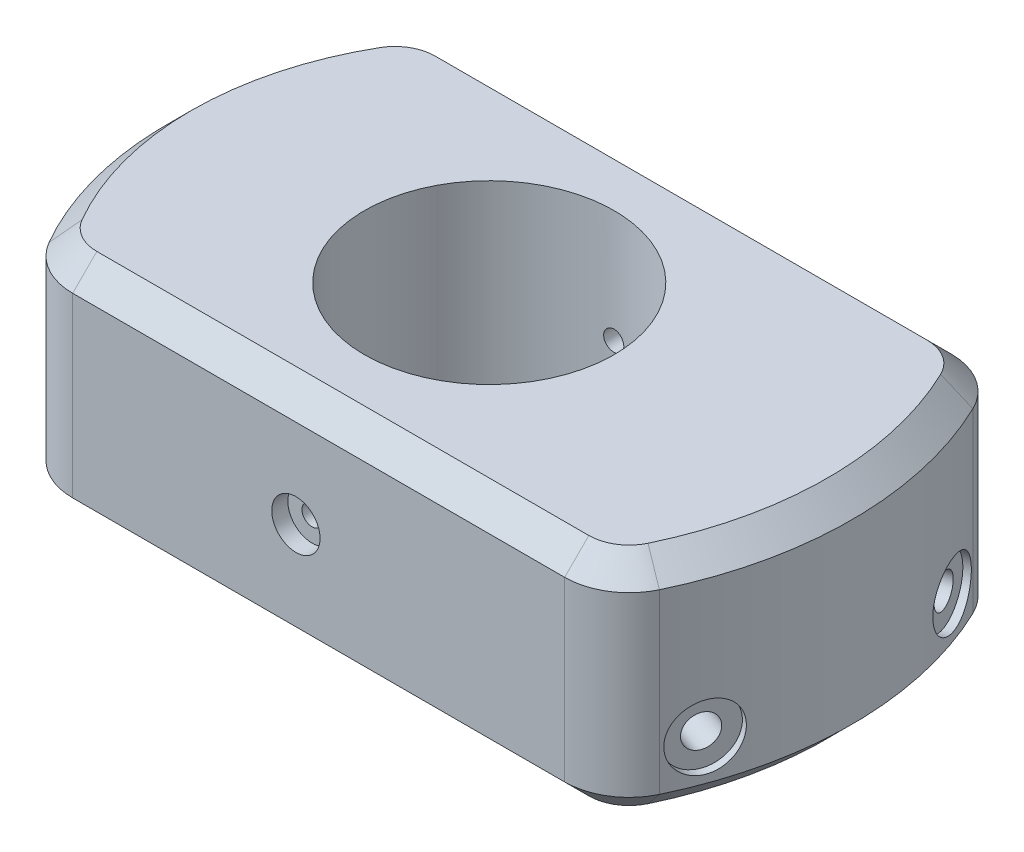
from build123d import *

# Parameters (mm, degrees)
SKETCH1_R               = 15.5
BOSS_EXTRUDE1_DEPTH     = 14
MOVE_START              = -14
MOVE_FACE1_DEPTH        = 28
CUT_EXTRUDE2_REACH      = 60.181
CUT_EXTRUDE2_END_RADIUS = 8.25
SKETCH5_R               = 2
SKETCH7_R               = 1.25
CUT_EXTRUDE3_DEPTH      = 68.268120394
FILLET1_R               = 8
CHAMFER1_SIZE           = 3
SKETCH8_R               = 3
CUT_EXTRUDE4_DEPTH      = 2


# Read off the part's stored shape, not the designer's step: Move Face1
with BuildPart() as part:
    # Sketch1 → Boss-Extrude1 (new, symmetric)
    with BuildSketch(Plane(origin=(0, 0, 0), x_dir=(1, 0, 0), z_dir=(0, 1, 0))):
        with BuildLine():
            Line((-32, 24), (32, 24))
            ThreePointArc((32, 24), (40, 0), (32, -24))
            Line((32, -24), (-32, -24))
            ThreePointArc((-32, -24), (-40, 0), (-32, 24))
        make_face()
        with Locations(Location((0, 0, 0), (0, 0, 270))):
            Circle(SKETCH1_R, mode=Mode.SUBTRACT)
    extrude(amount=BOSS_EXTRUDE1_DEPTH, both=True)

    # Sketch3 → Cut-Revolve1 (revolve, cut)
    with BuildSketch(Plane.XY):
        Polygon((-18, 2), (-19.432597466, 10.124663962), (-53.885297859, 4.049723325), (-52.452700394, -4.074940638), align=None)
    revolve(axis=Axis((-18, 2, 0), (-0.9848077530122092, -0.1736481776669237, 0)), mode=Mode.SUBTRACT)

    # Move Face1 outline → Move Face1 (add)
    with BuildSketch(Plane(origin=(0, 0, 0), x_dir=(1, 0, 0), z_dir=(0, 1, 0)).offset(MOVE_START)):
        with BuildLine():
            ThreePointArc((38.065732621, -24), (45, 0), (38.065732621, 24))
            Line((38.065732621, 24), (32, 24))
            ThreePointArc((32, 24), (40, 0), (32, -24))
            Line((32, -24), (38.065732621, -24))
        make_face()
    extrude(amount=MOVE_FACE1_DEPTH)

    # Sketch4 → Cut-Revolve2 (revolve, cut)
    with BuildSketch(Plane(origin=(0, 0, 0), x_dir=(0, -1, 0), z_dir=(-0.34202014332566943, 0, 0.9396926207859081)), mode=Mode.PRIVATE) as cut_revolve2_sk:
        Polygon((-6, 25), (-8.135257122, 32.968888067), (31.446035064, 43.574663343), (33.581292186, 35.605775277), align=None)
    cut_revolve2 = revolve(cut_revolve2_sk.sketch.rotate(Axis((23.49231552, 6, 8.550503583), (0.24321034680169487, -0.9659258262890681, 0.08852132690137743)), 160.629944791), axis=Axis((23.49231552, 6, 8.550503583), (0.24321034680169487, -0.9659258262890681, 0.08852132690137743)), mode=Mode.SUBTRACT)

    # Sketch6 → Cut-Revolve3 (revolve, cut)
    with BuildSketch(Plane(origin=(0, 0, 0), x_dir=(0, -1, 0), z_dir=(-0.34202014332566943, 0, 0.9396926207859081)), mode=Mode.PRIVATE) as cut_revolve3_sk:
        Polygon((4, 30), (6, 30), (6, 45), (6, 46), (2, 46), (2, 45), (2, 44), (4, 44), align=None)
    cut_revolve3 = revolve(cut_revolve3_sk.sketch.rotate(Axis((28.190778624, -6, 10.2606043), (0.9396926207859081, 0, 0.3420201433256695)), 90), axis=Axis((28.190778624, -6, 10.2606043), (0.9396926207859081, 0, 0.3420201433256695)), mode=Mode.SUBTRACT)

    # Mirror1: Cut-Revolve2, Cut-Revolve3 across plane
    add(cut_revolve2.mirror(Plane.XY), mode=Mode.SUBTRACT)
    add(cut_revolve3.mirror(Plane.XY), mode=Mode.SUBTRACT)

    # Cut-Extrude2: up to this cylinder (the profile starts outside it)
    cut_extrude2_end = Plane(origin=(-32.374316871, -0.534579894, 0), z_dir=(0.9848077530122092, 0.1736481776669237, 0)) * Cylinder(CUT_EXTRUDE2_END_RADIUS, 137.862, mode=Mode.PRIVATE)
    # Sketch5 → Cut-Extrude2 (cut, up to the surface)
    with BuildSketch(Plane.XZ.offset(14), mode=Mode.PRIVATE) as cut_extrude2_sk1:
        with Locations(Location((-30, 0, 0), (0, 0, 270))):
            Circle(SKETCH5_R)
    cut_extrude2_tool1 = extrude(cut_extrude2_sk1.sketch, amount=-CUT_EXTRUDE2_REACH, mode=Mode.PRIVATE) - cut_extrude2_end
    add(cut_extrude2_tool1.solids().sort_by_distance((-30, -14, 0))[0], mode=Mode.SUBTRACT)

    # Sketch7 → Cut-Extrude3 (cut, through all)
    with BuildSketch(Plane.XY.offset(24)):
        Circle(SKETCH7_R)
    extrude(amount=-CUT_EXTRUDE3_DEPTH, mode=Mode.SUBTRACT)

    # Fillet1
    fillet1_edges = [part.edges().sort_by_distance(p)[0] for p in [
        (-32, 0, -24),
        (38.065732621, 0, -24),
        (38.065732621, 0, 24),
        (-32, 0, 24),
    ]]
    fillet(fillet1_edges, radius=FILLET1_R)

    # Chamfer1
    chamfer1_edges = [part.edges().sort_by_distance(p)[0] for p in [
        (2.824420857, -14, -24),
        (2.824420857, 14, -24),
        (-40, -14, 0),
        (45, -14, 0),
        (2.824420857, -14, 24),
        (-31.712812921, -14, 22.92820323),
        (-31.712812921, -14, -22.92820323),
        (37.623363466, -14, 22.770364675),
        (37.623363466, -14, -22.770364675),
        (45, 14, 0),
        (-40, 14, 0),
        (2.824420857, 14, 24),
        (-31.712812921, 14, 22.92820323),
        (-31.712812921, 14, -22.92820323),
        (37.623363466, 14, 22.770364675),
        (37.623363466, 14, -22.770364675),
    ]]
    chamfer(chamfer1_edges, length=CHAMFER1_SIZE)

    # Sketch8 → Cut-Extrude4 (cut)
    with BuildSketch(Plane.XY.offset(24)):
        Circle(SKETCH8_R)
    cut_extrude4 = extrude(amount=-CUT_EXTRUDE4_DEPTH, mode=Mode.SUBTRACT)

    # Mirror2: Cut-Extrude4 across plane
    add(cut_extrude4.mirror(Plane.XY), mode=Mode.SUBTRACT)


solid = part.part
